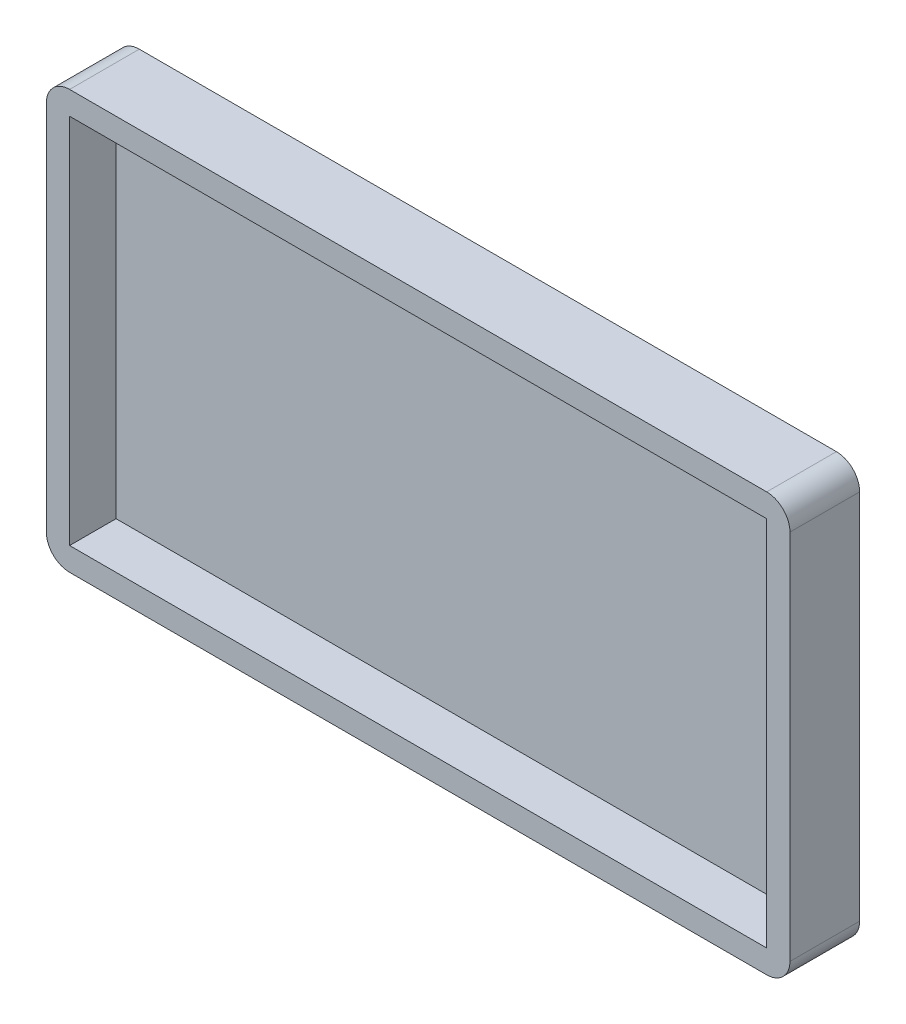
from build123d import *

# Parameters (mm, degrees)
SKETCH1_W           = 64
SKETCH1_H           = 36
BOSS_EXTRUDE1_DEPTH = 6
FILLET1_R           = 2
SKETCH2_W           = 60
SKETCH2_H           = 32
CUT_EXTRUDE1_DEPTH  = 4


with BuildPart() as part:
    # Sketch1 → Boss-Extrude1 (new body)
    with BuildSketch(Plane.XY):
        with Locations((32, -18)):
            Rectangle(SKETCH1_W, SKETCH1_H)
    extrude(amount=BOSS_EXTRUDE1_DEPTH)

    # Fillet1
    fillet1_edges = [part.edges().sort_by_distance(p)[0] for p in [
        (0, -36, 3),
        (64, -36, 3),
        (64, 0, 3),
        (0, 0, 3),
    ]]
    fillet(fillet1_edges, radius=FILLET1_R)

    # Sketch2 → Cut-Extrude1 (cut)
    with BuildSketch(Plane.XY.offset(6)):
        with Locations((32, -18)):
            Rectangle(SKETCH2_W, SKETCH2_H)
    extrude(amount=-CUT_EXTRUDE1_DEPTH, mode=Mode.SUBTRACT)


solid = part.part
